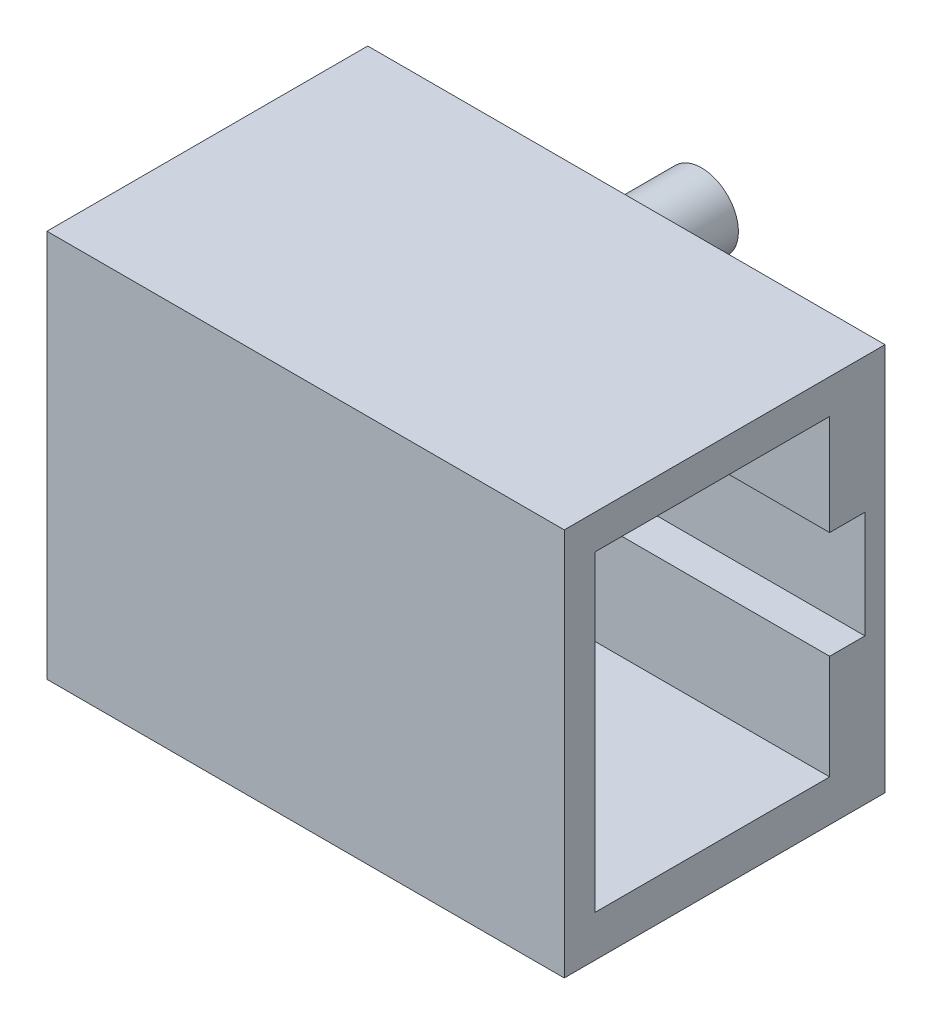
from build123d import *

# Parameters (mm, degrees)
SKETCH1_W          = 21.06
SKETCH1_H          = 15.8
EXTRUDE1_DEPTH     = 13.06
SKETCH2_R          = 1.5
EXTRUDE2_DEPTH     = 3.25
CUT_EXTRUDE1_DEPTH = 18


with BuildPart() as part:
    # Sketch1 → Extrude1 (new body)
    with BuildSketch(Plane.XY):
        with Locations((10.53, -7.9)):
            Rectangle(SKETCH1_W, SKETCH1_H)
    extrude(amount=EXTRUDE1_DEPTH)

    # Sketch2 → Extrude2 (add)
    with BuildSketch(Plane(origin=(0, 0, 0), x_dir=(-1, 0, 0), z_dir=(0, 0, -1))):
        with Locations((-10.34, -2.25)):
            Circle(SKETCH2_R)
        with Locations((-10.34, -13.68)):
            Circle(SKETCH2_R)
    extrude(amount=EXTRUDE2_DEPTH)

    # Sketch3 → Cut-Extrude1 (cut)
    with BuildSketch(Plane(origin=(21.06, 0, 0), x_dir=(0, 0, -1), z_dir=(1, 0, 0))):
        Polygon((-11.809509458, -14.113172182), (-11.809509458, -1.403202269), (-2.254873777, -1.403202269), (-2.254873777, -5.498046132), (-0.819019435, -5.498046132), (-0.819019435, -9.858788948), (-2.254873777, -9.858788948), (-2.254873777, -14.113172182), align=None)
    extrude(amount=-CUT_EXTRUDE1_DEPTH, mode=Mode.SUBTRACT)


solid = part.part
